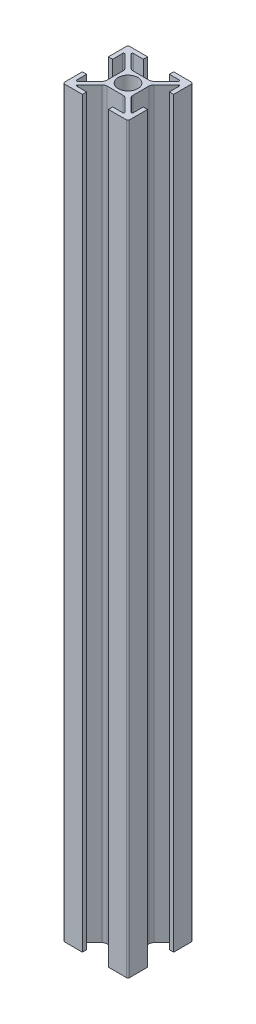
from build123d import *

# Parameters (mm, degrees)
ESBO_O1_R                = 3
RESSALTO_EXTRUS_O1_DEPTH = 228


with BuildPart() as part:
    # Esboço1 → Ressalto-extrusão1 (new body)
    with BuildSketch(Plane(origin=(0, 0, 0), x_dir=(1, 0, 0), z_dir=(0, 1, 0))):
        with BuildLine():
            Line((-7.056497116, 8.7), (-4, 8.7))
            Line((-4, 8.7), (-4, 10))
            Line((-4, 10), (-9.5, 10))
            ThreePointArc((-9.5, 10), (-9.853553391, 9.853553391), (-10, 9.5))
            Line((-10, 9.5), (-10, 4))
            Line((-10, 4), (-8.7, 4))
            Line((-8.7, 4), (-8.7, 7.056497116))
            ThreePointArc((-8.7, 7.056497116), (-8.51480503, 7.333660975), (-8.187867966, 7.26862915))
            Line((-8.187867966, 7.26862915), (-4.439339828, 3.520101013))
            ThreePointArc((-4.439339828, 3.520101013), (-4.114180701, 3.033465989), (-4, 2.459440841))
            Line((-4, 2.459440841), (-4, -2.459440841))
            ThreePointArc((-4, -2.459440841), (-4.114180701, -3.033465989), (-4.439339828, -3.520101013))
            Line((-4.439339828, -3.520101013), (-8.187867966, -7.26862915))
            ThreePointArc((-8.187867966, -7.26862915), (-8.51480503, -7.333660975), (-8.7, -7.056497116))
            Line((-8.7, -7.056497116), (-8.7, -4))
            Line((-8.7, -4), (-10, -4))
            Line((-10, -4), (-10, -9.5))
            ThreePointArc((-10, -9.5), (-9.853553391, -9.853553391), (-9.5, -10))
            Line((-9.5, -10), (-4, -10))
            Line((-4, -10), (-4, -8.7))
            Line((-4, -8.7), (-7.056497116, -8.7))
            ThreePointArc((-7.056497116, -8.7), (-7.333660975, -8.51480503), (-7.26862915, -8.187867966))
            Line((-7.26862915, -8.187867966), (-3.520101013, -4.439339828))
            ThreePointArc((-3.520101013, -4.439339828), (-3.033465989, -4.114180701), (-2.459440841, -4))
            Line((-2.459440841, -4), (2.459440841, -4))
            ThreePointArc((2.459440841, -4), (3.033465989, -4.114180701), (3.520101013, -4.439339828))
            Line((3.520101013, -4.439339828), (7.26862915, -8.187867966))
            ThreePointArc((7.26862915, -8.187867966), (7.333660975, -8.51480503), (7.056497116, -8.7))
            Line((7.056497116, -8.7), (4, -8.7))
            Line((4, -8.7), (4, -10))
            Line((4, -10), (9.5, -10))
            ThreePointArc((9.5, -10), (9.853553391, -9.853553391), (10, -9.5))
            Line((10, -9.5), (10, -4))
            Line((10, -4), (8.7, -4))
            Line((8.7, -4), (8.7, -7.056497116))
            ThreePointArc((8.7, -7.056497116), (8.51480503, -7.333660975), (8.187867966, -7.26862915))
            Line((8.187867966, -7.26862915), (4.439339828, -3.520101013))
            ThreePointArc((4.439339828, -3.520101013), (4.114180701, -3.033465989), (4, -2.459440841))
            Line((4, -2.459440841), (4, 2.459440841))
            ThreePointArc((4, 2.459440841), (4.114180701, 3.033465989), (4.439339828, 3.520101013))
            Line((4.439339828, 3.520101013), (8.187867966, 7.26862915))
            ThreePointArc((8.187867966, 7.26862915), (8.51480503, 7.333660975), (8.7, 7.056497116))
            Line((8.7, 7.056497116), (8.7, 4))
            Line((8.7, 4), (10, 4))
            Line((10, 4), (10, 9.5))
            ThreePointArc((10, 9.5), (9.853553391, 9.853553391), (9.5, 10))
            Line((9.5, 10), (4, 10))
            Line((4, 10), (4, 8.7))
            Line((4, 8.7), (7.056497116, 8.7))
            ThreePointArc((7.056497116, 8.7), (7.333660975, 8.51480503), (7.26862915, 8.187867966))
            Line((7.26862915, 8.187867966), (3.520101013, 4.439339828))
            ThreePointArc((3.520101013, 4.439339828), (3.033465989, 4.114180701), (2.459440841, 4))
            Line((2.459440841, 4), (-2.459440841, 4))
            ThreePointArc((-2.459440841, 4), (-3.033465989, 4.114180701), (-3.520101013, 4.439339828))
            Line((-3.520101013, 4.439339828), (-7.26862915, 8.187867966))
            ThreePointArc((-7.26862915, 8.187867966), (-7.333660975, 8.51480503), (-7.056497116, 8.7))
        make_face()
        Circle(ESBO_O1_R, mode=Mode.SUBTRACT)
    extrude(amount=RESSALTO_EXTRUS_O1_DEPTH)


solid = part.part
